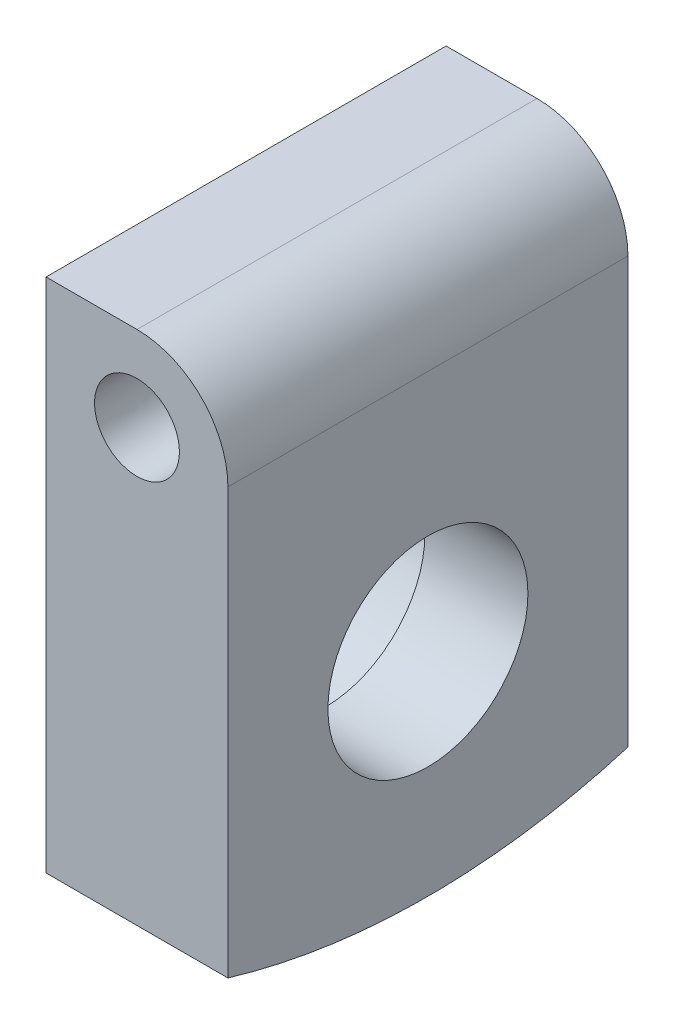
from build123d import *

# Parameters (mm, degrees)
BOSS_EXTRUDE1_DEPTH = 66
CUT_EXTRUDE2_START  = -17
SKETCH3_R           = 22.5
SKETCH3_R_2         = 16.5
CUT_EXTRUDE2_DEPTH  = 13
CUT_EXTRUDE3_REACH  = 117.568
SKETCH3_2_R         = 16.5
CUT_EXTRUDE5_DEPTH  = 116.568161866


with BuildPart() as part:
    # Sketch1 → Boss-Extrude1 (new body)
    with BuildSketch(Plane.XY):
        with BuildLine():
            Line((0, 0), (30, 0))
            Line((30, 0), (30, 75))
            ThreePointArc((30, 75), (25.606601718, 85.606601718), (15, 90))
            Line((15, 90), (0, 90))
            Line((0, 90), (0, 0))
        make_face()
    extrude(amount=BOSS_EXTRUDE1_DEPTH)

    # Sketch3 → Cut-Extrude2 (cut)
    with BuildSketch(Plane(origin=(30, 0, 0), x_dir=(0, 0, -1), z_dir=(1, 0, 0)).offset(CUT_EXTRUDE2_START)):
        with Locations((-33, 35)):
            Circle(SKETCH3_R)
        with Locations((-33, 35)):
            Circle(SKETCH3_R_2, mode=Mode.SUBTRACT)
    extrude(amount=-CUT_EXTRUDE2_DEPTH, mode=Mode.SUBTRACT)

    # Sketch3<2> → Cut-Extrude3 (cut, up to next)
    with BuildSketch(Plane(origin=(30, 0, 0), x_dir=(0, 0, -1), z_dir=(1, 0, 0)), mode=Mode.PRIVATE) as cut_extrude3_sk1:
        with Locations((-33, 35)):
            Circle(SKETCH3_2_R)
    cut_extrude3_tool1 = extrude(cut_extrude3_sk1.sketch, amount=-CUT_EXTRUDE3_REACH, mode=Mode.PRIVATE) & part.part
    add(cut_extrude3_tool1.solids().sort_by_distance((30, 35, 33))[0], mode=Mode.SUBTRACT)

    # Cut-Loft1: read off the stored shape, not the designer's step
    # Cut-Loft1: loft between two sections, ruled curve by curve
    cut_loft1_from = [
        Edge.make_bspline([(8.104234717, 77.203503702, 66), (10.511242121, 90.995034268, 66), (24.302772687, 88.588026864, 66), (21.895765283, 74.796496298, 66), (19.488757879, 61.004965732, 66), (5.697227313, 63.411973136, 66), (8.104234717, 77.203503702, 66)], [0, 0, 0, 0, 0.5, 0.5, 0.5, 1, 1, 1, 1], 3, [1, 0.333333333, 0.333333333, 1, 0.333333333, 0.333333333, 1]),
    ]
    cut_loft1_to = [
        Edge.make_bspline([(9.125428786, 74.779584885, 0), (6.684598557, 86.528727313, 0), (18.433740984, 88.969557543, 0), (20.874571214, 77.220415115, 0), (23.315401443, 65.471272687, 0), (11.566259016, 63.030442457, 0), (9.125428786, 74.779584885, 0)], [0, 0, 0, 0, 0.5, 0.5, 0.5, 1, 1, 1, 1], 3, [1, 0.333333333, 0.333333333, 1, 0.333333333, 0.333333333, 1]),
    ]
    cut_loft1 = Solid(Shell([*[Face.make_surface_from_curves(cut_loft1_from[k], cut_loft1_to[k]) for k in range(1)], Face(Wire(cut_loft1_from)), Face(Wire(cut_loft1_to))]))
    add(cut_loft1, mode=Mode.SUBTRACT)

    # Sketch8 → Cut-Extrude5 (cut, through all)
    with BuildSketch(Plane.ZY):
        with BuildLine():
            ThreePointArc((33.000000237, 0), (16.323732633, 1.215545408), (0, 4.836485169))
            Line((0, 4.836485169), (0, 0))
            Line((0, 0), (33.000000237, 0))
        make_face()
        with BuildLine():
            ThreePointArc((66, 4.836485169), (49.676267601, 1.215545443), (33.000000237, 0))
            Line((33.000000237, 0), (66, 0))
            Line((66, 0), (66, 4.836485169))
        make_face()
    extrude(amount=-CUT_EXTRUDE5_DEPTH, mode=Mode.SUBTRACT)


solid = part.part
